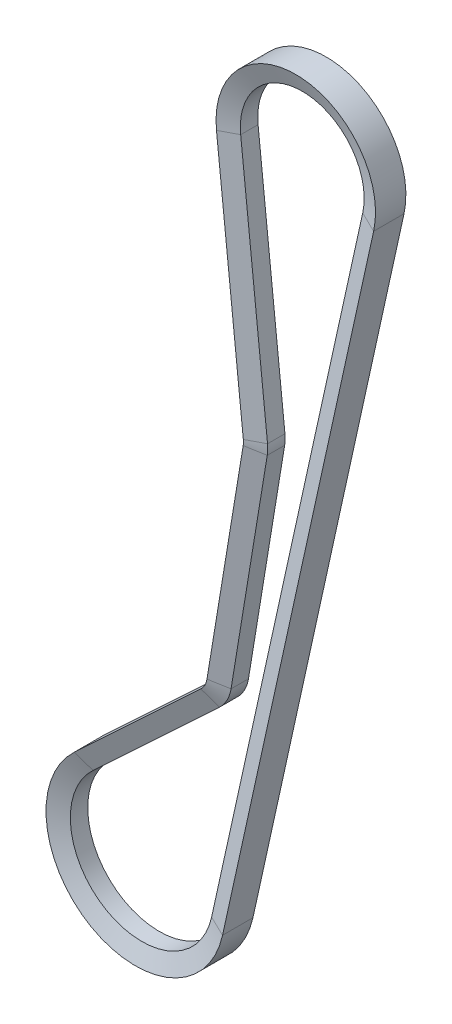
from build123d import *


with BuildPart() as part:
    # Sweep1: sweep along a path in Sketch2
    with BuildLine(Plane.XY) as sweep1_path:
        Line((24.413530175, -5.383265216), (-22.954799029, -220.202355123))
        ThreePointArc((-22.954799029, -220.202355123), (-64.173049258, -238.493494849), (-69.40259212, -193.703296972))
        Line((-69.40259212, -193.703296972), (-29.768559854, -156.712517913))
        ThreePointArc((-29.768559854, -156.712517913), (-28.502439798, -155.06628516), (-27.835199568, -153.099579094))
        Line((-27.835199568, -153.099579094), (-16.488368806, -84.02534778))
        ThreePointArc((-16.488368806, -84.02534778), (-16.407015905, -83.178683258), (-16.439546428, -82.328741571))
        Line((-16.439546428, -82.328741571), (-24.861582415, -2.627112446))
        ThreePointArc((-24.861582415, -2.627112446), (1.396166976, 24.96098391), (24.413530175, -5.383265216))
    # Sketch3 → Sweep1 (sweep)
    with BuildSketch(Plane(origin=(-24.861582415, -2.627112446, 0), x_dir=(0.9944632966162825, 0.10508449782473064, 0), z_dir=(-0.10508449782473064, 0.9944632966162825, 0))):
        Polygon((0, -4.7625), (0, 4.7625), (5.588, 2.728634331), (5.588, -2.728634331), align=None)
    sweep(path=sweep1_path.line)


solid = part.part
